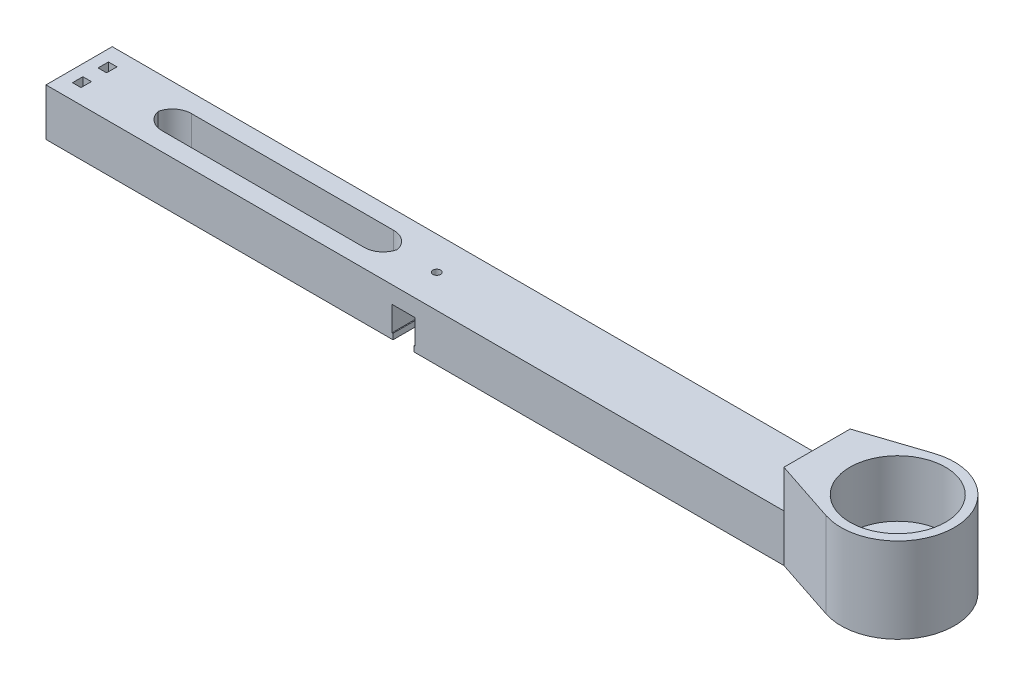
from build123d import *

# Parameters (mm, degrees)
SKETCH2_W                = 210
SKETCH2_H                = 35
BOSS_EXTRUDE1_DEPTH      = 25
SKETCH3_R                = 5.6
CUT_EXTRUDE1_DEPTH       = 213.205678529
CUT_EXTRUDE2_DEPTH       = 22
SKETCH6_W                = 22.496439662
SKETCH6_H                = 9
BOSS_EXTRUDE3_DEPTH      = 38
CUT_EXTRUDE4_DEPTH       = 17.5
SKETCH9_R                = 2
CUT_EXTRUDE5_DEPTH       = 38
SKETCH10_R               = 2
CUT_EXTRUDE6_DEPTH       = 30
SKETCH12_W               = 4.5
SKETCH12_H               = 5.5
CUT_EXTRUDE7_DEPTH       = 46
SKETCH14_W               = 126.950126738
SKETCH14_H               = 15.619509634
CUT_EXTRUDE8_DEPTH       = 40
FILLET1_R                = 10
SKETCH17_W               = 35
SKETCH17_H               = 25
BOSS_EXTRUDE5_DEPTH      = 180
BOSS_EXTRUDE4_DEPTH      = 20
BOSS_EXTRUDE4_DEPTH_BACK = 25
SKETCH18_R               = 3.130352174
CUT_EXTRUDE9_DEPTH       = 10
SKETCH20_R               = 25.25
CUT_EXTRUDE11_DEPTH      = 30


with BuildPart() as part:
    # Sketch2 → Boss-Extrude1 (new body)
    with BuildSketch(Plane(origin=(0, 0, 0), x_dir=(1, 0, 0), z_dir=(0, 1, 0))):
        with Locations((-105, 0)):
            Rectangle(SKETCH2_W, SKETCH2_H)
    extrude(amount=BOSS_EXTRUDE1_DEPTH)

    # Sketch3 → Cut-Extrude1 (cut, through all)
    with BuildSketch(Plane.XZ):
        with Locations(Location((-21, 0, 0), (0, 0, 270))):
            Circle(SKETCH3_R)
    extrude(amount=-CUT_EXTRUDE1_DEPTH, mode=Mode.SUBTRACT)

    # Sketch4 → Cut-Extrude2 (cut)
    with BuildSketch(Plane(origin=(0, 25, 0), x_dir=(1, 0, 0), z_dir=(0, 1, 0))):
        Polygon((-14.9, 3.521836642), (-21, 7.043673284), (-27.1, 3.521836642), (-27.1, -3.521836642), (-21, -7.043673284), (-14.9, -3.521836642), align=None)
    extrude(amount=-CUT_EXTRUDE2_DEPTH, mode=Mode.SUBTRACT)

    # Sketch6 → Boss-Extrude3 (add)
    with BuildSketch(Plane(origin=(0, 0, 0), x_dir=(0, 0, -1), z_dir=(1, 0, 0))):
        with Locations((0.204742288, 20.5)):
            Rectangle(SKETCH6_W, SKETCH6_H)
    extrude(amount=-BOSS_EXTRUDE3_DEPTH)

    # Sketch7 → Cut-Extrude4 (cut)
    with BuildSketch(Plane.XY.offset(17.5)):
        Polygon((-21, 16), (-14.9, 16), (-14.9, 3), (-15.4, 3), (-15.4, 0), (-26.6, 0), (-26.6, 3), (-27.1, 3), (-27.1, 16), align=None)
    extrude(amount=-CUT_EXTRUDE4_DEPTH, mode=Mode.SUBTRACT)

    # Sketch9 → Cut-Extrude5 (cut)
    with BuildSketch(Plane(origin=(0, 25, 0), x_dir=(1, 0, 0), z_dir=(0, 1, 0))):
        with Locations(Location((-21, 0, 0), (0, 0, 270))):
            Circle(SKETCH9_R)
    extrude(amount=-CUT_EXTRUDE5_DEPTH, mode=Mode.SUBTRACT)

    # Sketch10 → Cut-Extrude6 (cut)
    with BuildSketch(Plane.ZY.offset(210)):
        with Locations((7, 19)):
            Circle(SKETCH10_R)
        with Locations((7, 6)):
            Circle(SKETCH10_R)
        with Locations((-7, 6)):
            Circle(SKETCH10_R)
        with Locations((-7, 19)):
            Circle(SKETCH10_R)
    extrude(amount=-CUT_EXTRUDE6_DEPTH, mode=Mode.SUBTRACT)

    # Sketch12 → Cut-Extrude7 (cut)
    with BuildSketch(Plane(origin=(0, 25, 0), x_dir=(1, 0, 0), z_dir=(0, 1, 0))):
        with Locations((-201.75, -6.75)):
            Rectangle(SKETCH12_W, SKETCH12_H)
        with Locations((-201.75, 6.75)):
            Rectangle(SKETCH12_W, SKETCH12_H)
    extrude(amount=-CUT_EXTRUDE7_DEPTH, mode=Mode.SUBTRACT)

    # Sketch14 → Cut-Extrude8 (cut)
    with BuildSketch(Plane(origin=(0, 25, 0), x_dir=(1, 0, 0), z_dir=(0, 1, 0))):
        with Locations((-105, 0)):
            Rectangle(SKETCH14_W, SKETCH14_H)
    extrude(amount=-CUT_EXTRUDE8_DEPTH, mode=Mode.SUBTRACT)

    # Fillet1
    # the kernel refuses this fillet: 10 mm, written as the material it adds along each edge
    with BuildSketch(Plane(origin=(-168.475063369, 25, 7.809754817), x_dir=(0, 0, -1), z_dir=(0, -1, 0)), Plane(origin=(-41.524936631, 25, 7.809754817), x_dir=(-1, 0, 0), z_dir=(0, -1, 0)), Plane(origin=(-41.524936631, 25, -7.809754817), x_dir=(0, 0, 1), z_dir=(0, -1, 0))) as fillet1_piece_1:
        with BuildLine():
            CenterArc((FILLET1_R, FILLET1_R), FILLET1_R, 180, 90)
            Line((0, FILLET1_R), (0, 0))
            Line((0, 0), (FILLET1_R, 0))
        make_face()
    extrude(amount=25)
    with BuildSketch(Plane(origin=(-168.475063369, 25, -7.809754817), x_dir=(0, 0, 1), z_dir=(0, -1, 0))) as fillet1_piece_2:
        with BuildLine():
            CenterArc((FILLET1_R, -FILLET1_R), FILLET1_R, 90, 90)
            Line((0, -FILLET1_R), (0, 0))
            Line((0, 0), (FILLET1_R, 0))
        make_face()
    extrude(amount=25)

    # Sketch17 → Boss-Extrude5 (add)
    with BuildSketch(Plane(origin=(0, 0, 0), x_dir=(0, 0, -1), z_dir=(1, 0, 0))):
        with Locations((0, 12.5)):
            Rectangle(SKETCH17_W, SKETCH17_H)
    extrude(amount=BOSS_EXTRUDE5_DEPTH)

    # Sketch16 → Boss-Extrude4 (add, two sides: drawn at the far end of the back side and taken through both)
    with BuildSketch(Plane(origin=(0, 25, 0), x_dir=(1, 0, 0), z_dir=(0, 1, 0)).offset(-BOSS_EXTRUDE4_DEPTH_BACK)):
        with BuildLine():
            Line((213.231687746, 28.484303782), (180, 17.5))
            Line((180, 17.5), (180, -17.5))
            Line((180, -17.5), (213.231687746, -28.484303782))
            ThreePointArc((213.231687746, -28.484303782), (252.646805273, 0), (213.231687746, 28.484303782))
        make_face()
    extrude(amount=BOSS_EXTRUDE4_DEPTH + BOSS_EXTRUDE4_DEPTH_BACK)

    # Sketch18 → Cut-Extrude9 (cut)
    with BuildSketch(Plane.ZY.offset(210)):
        with Locations((0, 12.5)):
            Circle(SKETCH18_R)
    extrude(amount=-CUT_EXTRUDE9_DEPTH, mode=Mode.SUBTRACT)

    # Sketch20 → Cut-Extrude11 (cut)
    with BuildSketch(Plane(origin=(0, 45, 0), x_dir=(1, 0, 0), z_dir=(0, 1, 0))):
        with Locations(Location((222.646805273, 0, 0), (0, 0, 270))):
            Circle(SKETCH20_R)
    extrude(amount=-CUT_EXTRUDE11_DEPTH, mode=Mode.SUBTRACT)


solid = part.part
